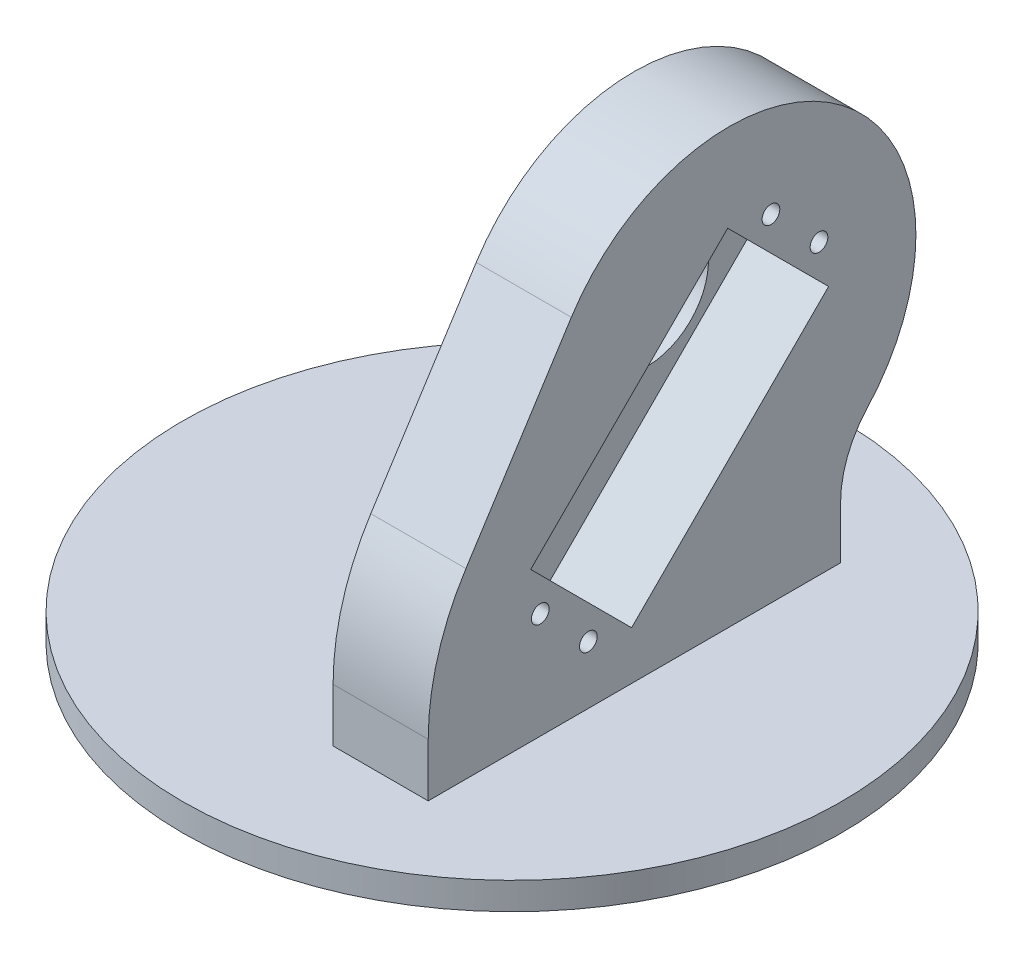
from build123d import *

# Parameters (mm, degrees)
SKETCH1_R           = 48.5
SKETCH1_R_2         = 1.5
BOSS_EXTRUDE1_DEPTH = 4
SKETCH2_R           = 3.75
CUT_EXTRUDE1_DEPTH  = 1.5
BOSS_EXTRUDE2_START = 4
SKETCH3_R           = 9
BOSS_EXTRUDE2_DEPTH = 14
CUT_EXTRUDE2_START  = 6
SKETCH5_R           = 1.3
CUT_EXTRUDE2_DEPTH  = 91.444646155


with BuildPart() as part:
    # Sketch1 → Boss-Extrude1 (new body)
    with BuildSketch(Plane(origin=(0, 0, 0), x_dir=(1, 0, 0), z_dir=(0, 1, 0))):
        Circle(SKETCH1_R)
        with Locations((0, -7.25)):
            Circle(SKETCH1_R_2, mode=Mode.SUBTRACT)
        with Locations((0, 7.25)):
            Circle(SKETCH1_R_2, mode=Mode.SUBTRACT)
    extrude(amount=BOSS_EXTRUDE1_DEPTH)

    # Sketch2 → Cut-Extrude1 (cut)
    with BuildSketch(Plane(origin=(0, 4, 0), x_dir=(1, 0, 0), z_dir=(0, 1, 0))):
        Circle(SKETCH2_R)
    extrude(amount=-CUT_EXTRUDE1_DEPTH, mode=Mode.SUBTRACT)

    # Sketch3 → Boss-Extrude2 (add)
    with BuildSketch(Plane(origin=(0, 0, 0), x_dir=(0, 0, -1), z_dir=(1, 0, 0)).offset(BOSS_EXTRUDE2_START)):
        with BuildLine():
            Line((30.34, 4), (-30.34, 4))
            Line((-30.34, 4), (-30.34, 11.86))
            ThreePointArc((-30.34, 11.86), (-28.924736696, 21.745164753), (-24.792654999, 30.836113728))
            Line((-24.792654999, 30.836113728), (-9.278105641, 55.104149989))
            ThreePointArc((-9.278105641, 55.104149989), (30.651097233, 62.12443475), (34.252718415, 21.743078098))
            ThreePointArc((34.252718415, 21.743078098), (31.352340729, 17.057138369), (30.34, 11.64))
            Line((30.34, 11.64), (30.34, 4))
        make_face()
        with Locations((13.91, 40.28)):
            Circle(SKETCH3_R, mode=Mode.SUBTRACT)
    extrude(amount=BOSS_EXTRUDE2_DEPTH)

    # Sketch5 → Cut-Extrude2 (cut, through all)
    with BuildSketch(Plane(origin=(0, 0, 0), x_dir=(0, 0, -1), z_dir=(1, 0, 0)).offset(CUT_EXTRUDE2_START)):
        with Locations((20.096096654, 53.536406871)):
            Circle(SKETCH5_R)
        with Locations((27.167164466, 46.465339059)):
            Circle(SKETCH5_R)
        with Locations((-6.773961031, 12.524213562)):
            Circle(SKETCH5_R)
        with Locations((-13.845028843, 19.595281374)):
            Circle(SKETCH5_R)
        Polygon((-15.259242405, 25.959242405), (-0.41, 11.11), (28.581378029, 40.101378029), (13.732135624, 54.950620434), align=None)
    extrude(amount=CUT_EXTRUDE2_DEPTH, mode=Mode.SUBTRACT)


solid = part.part
